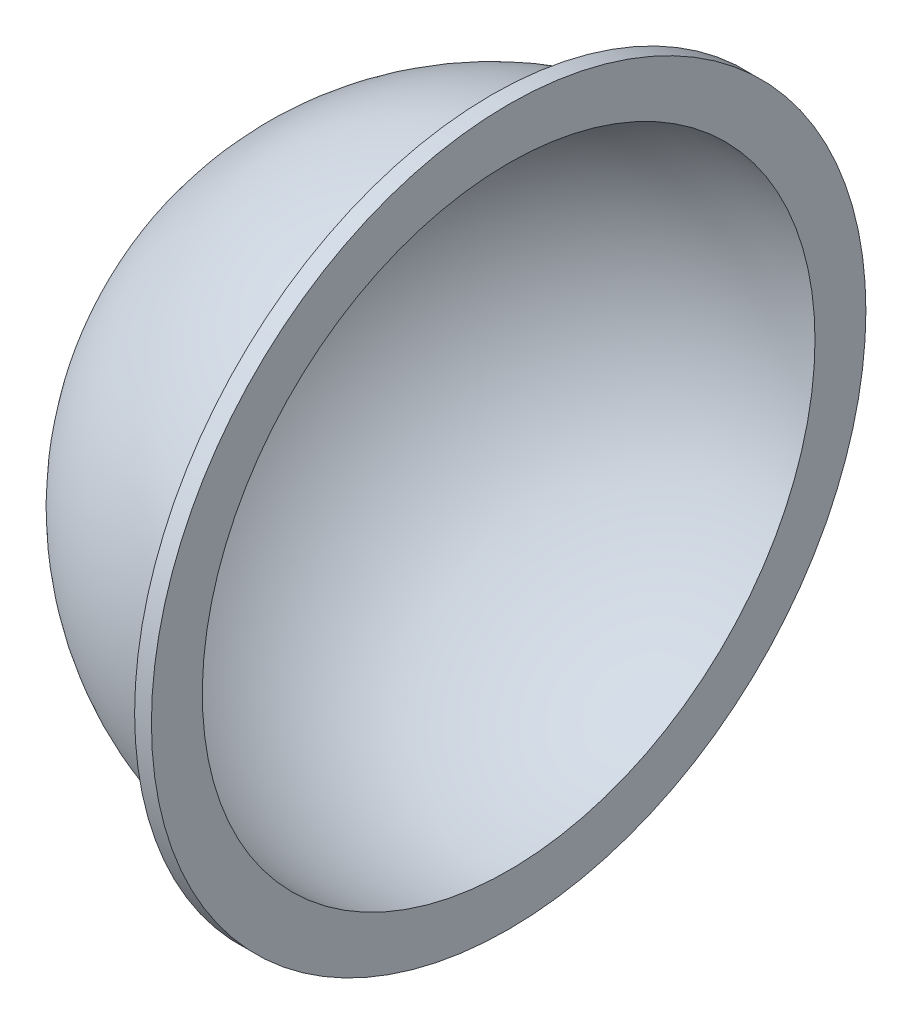
from build123d import *

# Parameters (mm, degrees)
SCALE1_SCALE = 0.8


with BuildPart() as part:
    # Sketch1 → Revolve1 (revolve)
    with BuildSketch(Plane.XY):
        with BuildLine():
            ThreePointArc((-36.5, 0), (-25.092329505, 26.507074527), (2, 36.445164288))
            Line((2, 36.445164288), (2, 42.5))
            Line((2, 42.5), (0, 42.5))
            Line((0, 42.5), (0, 37.5))
            ThreePointArc((0, 37.5), (-26.516504294, 26.516504294), (-37.5, 0))
            Line((-37.5, 0), (-36.5, 0))
        make_face()
    revolve(axis=Axis((0, 0, 0), (-1, 0, 0)))


with BuildPart() as part_1:
    # Scale1: scaled about (0, 0, 0)
    add(part.part.scale(SCALE1_SCALE))


solid = part_1.part
